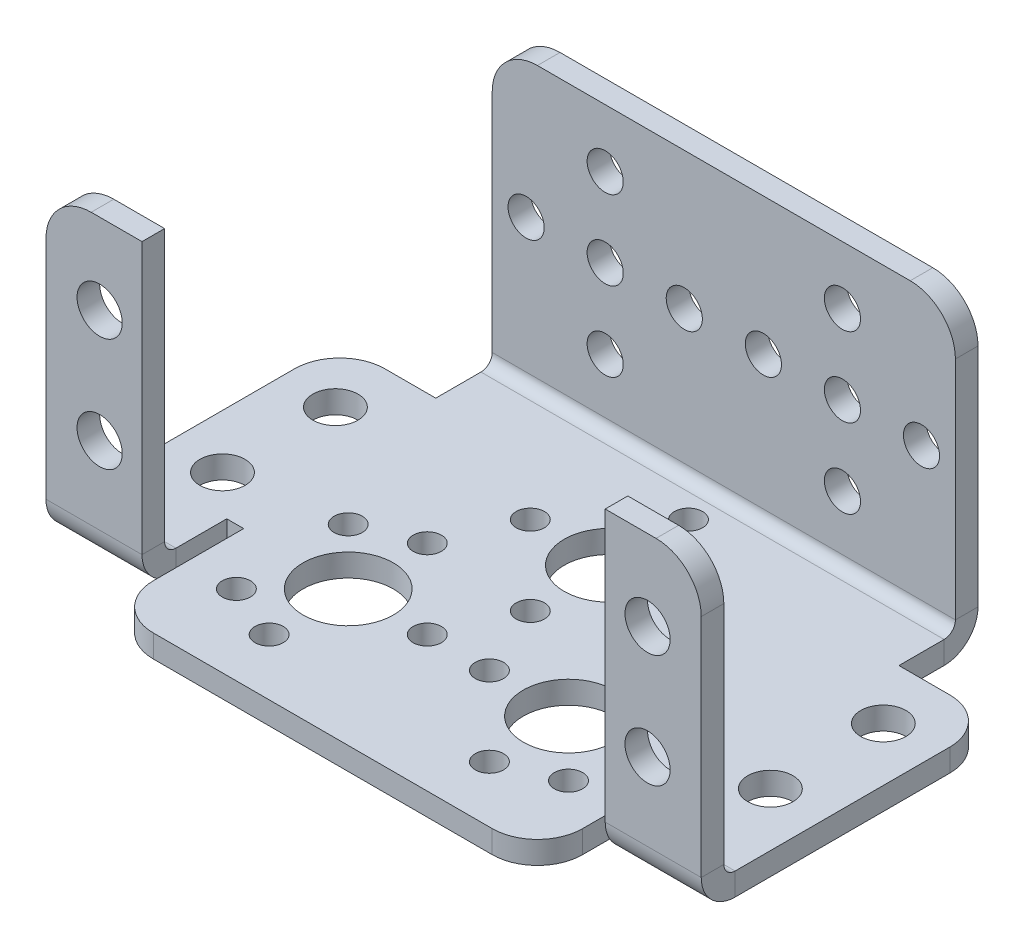
from build123d import *

# Parameters (mm, degrees)
T_LE_DE_BASE_PLI_E1_DEPTH             = 20.5
ESQUISSE8_W                           = 24
ESQUISSE8_H                           = 2
BOSS_EXTRU_1_DEPTH                    = 8.5
T_LE_PLI_E_SUR_AR_TE1_STRIP_W         = 10
T_LE_PLI_E_SUR_AR_TE1_STRIP_H         = 2
T_LE_PLI_E_SUR_AR_TE1_STRIP_CUT_DEPTH = 8.5
T_LE_PLI_E_SUR_AR_TE1_DEPTH           = 8.5
ESQUISSE12_W                          = 1.5
ESQUISSE12_H                          = 12
ENL_V_MAT_EXTRU_1_DEPTH               = 8.5
DIAM_TRE_DU_PER_AGE_4_0_4_1_D         = 4
DIAM_TRE_DU_PER_AGE_8_0_8_1_D         = 8
DIAM_TRE_DU_PER_AGE_2_5_2_5_1_D       = 2.5
R_P_TITION_CIRCULAIRE1_COUNT          = 8
DIAM_TRE_DU_PER_AGE_4_0_4_2_D         = 4
HOLE_WIZARD_3_2_3_2_1_D               = 3.2
CONG_1_R                              = 4
DIAM_TRE_DU_PER_AGE_8_0_8_2_D         = 8
DIAM_TRE_DU_PER_AGE_2_5_2_5_3_D       = 2.5
R_P_TITION_CIRCULAIRE2_COUNT          = 4


# Sheet-metal steps are written as plain solids
with BuildPart() as part:
    # Esquisse1 → Tôle de base pliée1 (new body)
    with BuildSketch(Plane(origin=(0, 0, 0), x_dir=(0, 0, -1), z_dir=(1, 0, 0))):
        with BuildLine():
            Line((0, 27), (0, 3))
            ThreePointArc((0, 3), (-0.878679656, 0.878679656), (-3, 0))
            Line((-3, 0), (-37.5, 0))
            Line((-37.5, 0), (-37.5, 2))
            Line((-37.5, 2), (-3, 2))
            ThreePointArc((-3, 2), (-2.292893219, 2.292893219), (-2, 3))
            Line((-2, 3), (-2, 27))
            Line((-2, 27), (0, 27))
        make_face()
    extrude(amount=T_LE_DE_BASE_PLI_E1_DEPTH)

    # Esquisse8 → Boss.-Extru.1 (add)
    with BuildSketch(Plane(origin=(20.5, 0, 0), x_dir=(0, 0, -1), z_dir=(1, 0, 0))):
        with Locations((-19, 1)):
            Rectangle(ESQUISSE8_W, ESQUISSE8_H)
    extrude(amount=BOSS_EXTRU_1_DEPTH)

    # Tôle pliée sur arête1 strip (across the edge) → Tôle pliée sur arête1 strip cut (cut)
    with BuildSketch(Plane(origin=(20.5, 2, 31), x_dir=(0, 0, -1), z_dir=(1, 0, 0))):
        with Locations((-4, -1)):
            Rectangle(T_LE_PLI_E_SUR_AR_TE1_STRIP_W, T_LE_PLI_E_SUR_AR_TE1_STRIP_H)
    extrude(amount=T_LE_PLI_E_SUR_AR_TE1_STRIP_CUT_DEPTH, mode=Mode.SUBTRACT)

    # Tôle pliée sur arête1 section (across the edge) → Tôle pliée sur arête1 (add)
    with BuildSketch(Plane(origin=(20.5, 2, 31), x_dir=(0, 0, -1), z_dir=(1, 0, 0))):
        with BuildLine():
            Line((-2, 1), (-2, 25))
            Line((-2, 25), (0, 25))
            Line((0, 25), (0, 1))
            ThreePointArc((0, 1), (0.292893219, 0.292893219), (1, 0))
            Line((1, 0), (1, -2))
            ThreePointArc((1, -2), (-1.121320344, -1.121320344), (-2, 1))
        make_face()
    extrude(amount=T_LE_PLI_E_SUR_AR_TE1_DEPTH)

    # Esquisse12 → Enlèv. mat.-Extru.1 (cut)
    with BuildSketch(Plane(origin=(0, 2, 0), x_dir=(1, 0, 0), z_dir=(0, 1, 0))):
        with Locations((19.75, -31.5)):
            Rectangle(ESQUISSE12_W, ESQUISSE12_H)
    extrude(amount=-ENL_V_MAT_EXTRU_1_DEPTH, mode=Mode.SUBTRACT)

    # Diamètre du perçage Ø4.0 (4)1 (through all)
    with Locations(Plane(origin=(0, 2, 0), x_dir=(1, 0, 0), z_dir=(0, 1, 0))):
        with Locations((24.25, -12.13), (24.25, -22.13)):
            Hole(DIAM_TRE_DU_PER_AGE_4_0_4_1_D / 2)

    # Diamètre du perçage Ø8.0 (8)1 (through all)
    with Locations(Plane(origin=(0, 2, 0), x_dir=(1, 0, 0), z_dir=(0, 1, 0))):
        with Locations((9.75, -25.5)):
            Hole(DIAM_TRE_DU_PER_AGE_8_0_8_1_D / 2)

    # Diamètre du perçage Ø2.5 (2.5)1 (through all)
    with Locations(Plane(origin=(0, 2, 0), x_dir=(1, 0, 0), z_dir=(0, 1, 0))):
        with Locations((9.75, -18.5)):
            diam_tre_du_per_age_2_5_2_5_1 = Hole(DIAM_TRE_DU_PER_AGE_2_5_2_5_1_D / 2)

    # Répétition circulaire1: Diamètre du perçage Ø2.5 (2.5)1 ×8 about axis, 3 skipped
    r_p_tition_circulaire1_axis = Axis((9.75, 2, 25.5), (0, 1, 0))
    add([diam_tre_du_per_age_2_5_2_5_1.rotate(r_p_tition_circulaire1_axis, i * 360 / R_P_TITION_CIRCULAIRE1_COUNT) for i in range(1, R_P_TITION_CIRCULAIRE1_COUNT) if i not in (1, 3, 6)], mode=Mode.SUBTRACT)

    # Diamètre du perçage Ø4.0 (4)2 (through all)
    with Locations(Plane.XY.offset(33)):
        with Locations((24.25, 19.87), (24.25, 9.87)):
            Hole(DIAM_TRE_DU_PER_AGE_4_0_4_2_D / 2)

    # Ø3.2 (3.2) 直径孔1 (through all)
    with Locations(Plane.XY.offset(2)):
        with Locations((10.5, 14.87), (10.5, 21.87), (17.5, 14.87), (10.5, 7.87), (3.5, 14.87)):
            Hole(HOLE_WIZARD_3_2_3_2_1_D / 2)

    # Congé1
    cong_1_edges = [part.edges().sort_by_distance(p)[0] for p in [
        (20.5, 27, 1),
        (29, 1, 7),
        (29, 27, 32),
        (19, 1, 37.5),
    ]]
    fillet(cong_1_edges, radius=CONG_1_R)

    # Symétrie1: part across plane


with BuildPart() as part_1:
    add(part.part)
    add(part.part.mirror(Plane(origin=(0, 3, 3), x_dir=(0, 0, 1), z_dir=(1, 0, 0))))

    # Diamètre du perçage Ø8.0 (8)2 (through all)
    with Locations(Plane(origin=(0, 2, 0), x_dir=(1, 0, 0), z_dir=(0, 1, 0))):
        with Locations((0, -12.13)):
            Hole(DIAM_TRE_DU_PER_AGE_8_0_8_2_D / 2)

    # Diamètre du perçage Ø2.5 (2.5)3 (through all)
    with Locations(Plane(origin=(0, 2, 0), x_dir=(1, 0, 0), z_dir=(0, 1, 0))):
        with Locations((0, -5.13)):
            diam_tre_du_per_age_2_5_2_5_3 = Hole(DIAM_TRE_DU_PER_AGE_2_5_2_5_3_D / 2)

    # Répétition circulaire2: Diamètre du perçage Ø2.5 (2.5)3 ×4 about axis
    r_p_tition_circulaire2_axis = Axis((0, 0, 12.13), (0, 1, 0))
    for i in range(1, R_P_TITION_CIRCULAIRE2_COUNT):
        add(diam_tre_du_per_age_2_5_2_5_3.rotate(r_p_tition_circulaire2_axis, i * 360 / R_P_TITION_CIRCULAIRE2_COUNT), mode=Mode.SUBTRACT)


solid = part_1.part
